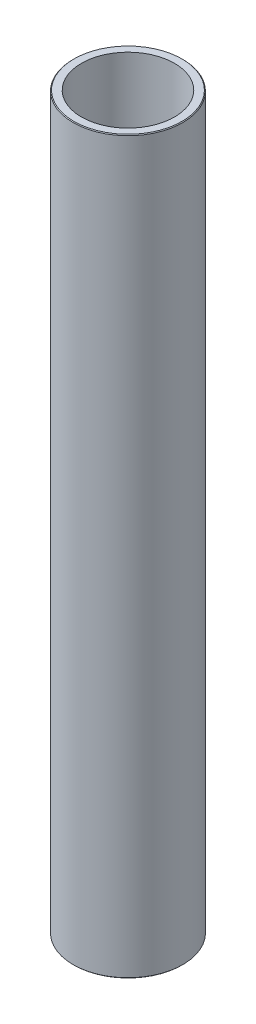
from build123d import *

# Parameters (mm, degrees)
SKETCH1_R           = 45
BOSS_EXTRUDE1_DEPTH = 600
SKETCH2_R           = 38.22047769
CUT_EXTRUDE1_DEPTH  = 604.365560834
CHAMFER1_SIZE       = 0.599773339


with BuildPart() as part:
    # Sketch1 → Boss-Extrude1 (new body)
    with BuildSketch(Plane(origin=(0, 0, 0), x_dir=(1, 0, 0), z_dir=(0, 1, 0))):
        Circle(SKETCH1_R)
    extrude(amount=BOSS_EXTRUDE1_DEPTH)

    # Sketch2 → Cut-Extrude1 (cut, through all)
    with BuildSketch(Plane(origin=(0, 0, 0), x_dir=(1, 0, 0), z_dir=(0, 1, 0))):
        Circle(SKETCH2_R)
    extrude(amount=CUT_EXTRUDE1_DEPTH, mode=Mode.SUBTRACT)

    # Chamfer1
    chamfer1_edges = [part.edges().sort_by_distance(p)[0] for p in [
        (-45, 600, 0),
        (-45, 0, 0),
    ]]
    chamfer(chamfer1_edges, length=CHAMFER1_SIZE)


solid = part.part
